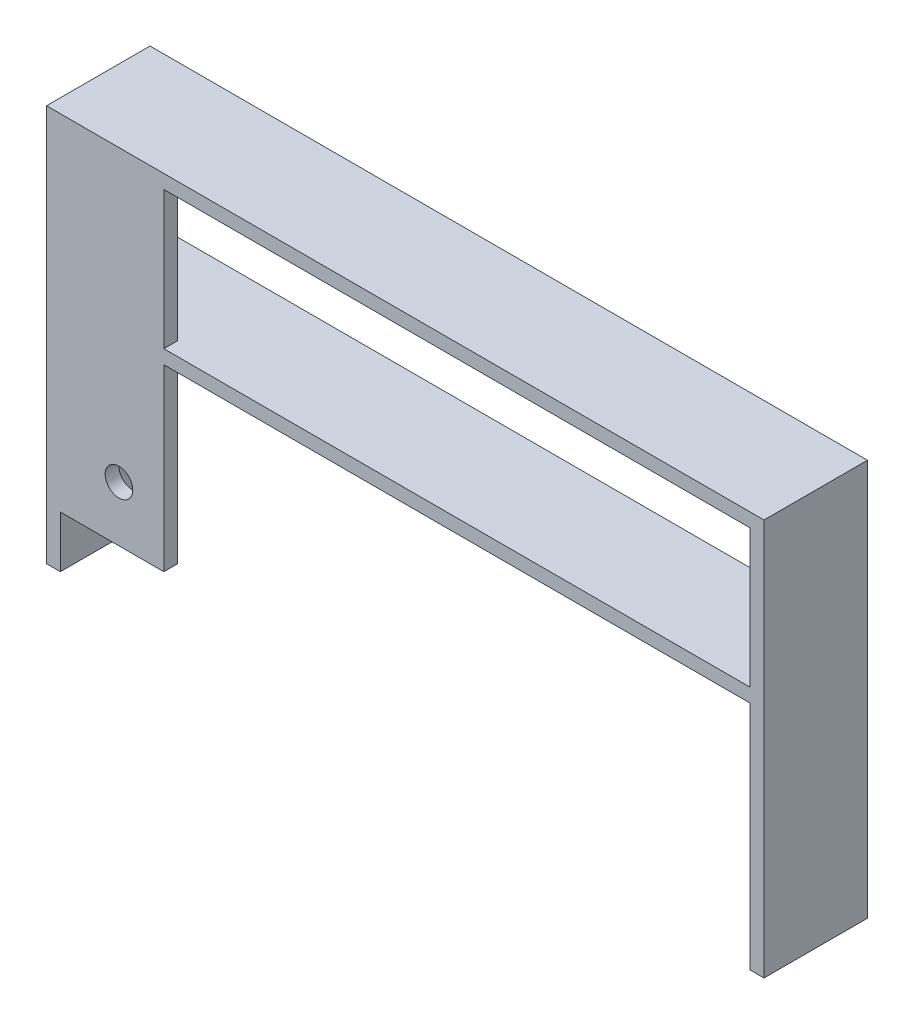
from build123d import *

# Parameters (mm, degrees)
SKETCH1_W           = 100
SKETCH1_H           = 20
BOSS_EXTRUDE1_DEPTH = 15
SKETCH2_W           = 15
SKETCH2_H           = 20
BOSS_EXTRUDE2_DEPTH = 2
SKETCH3_W           = 15
SKETCH3_H           = 26
BOSS_EXTRUDE3_DEPTH = 2
CUT_EXTRUDE1_REACH  = 119.81
SKETCH4_R           = 2


with BuildPart() as part:
    # Sketch1 → Boss-Extrude1 (new body)
    with BuildSketch(Plane.XY):
        Polygon((0, 0), (0, 33.5), (100, 33.5), (100, 0), (102, 0), (102, 57.5), (-2, 57.5), (-2, 0), align=None)
        with Locations((50, 45.5)):
            Rectangle(SKETCH1_W, SKETCH1_H, mode=Mode.SUBTRACT)
    extrude(amount=BOSS_EXTRUDE1_DEPTH)

    # Sketch2 → Boss-Extrude2 (add)
    with BuildSketch(Plane(origin=(0, 0, 15), x_dir=(-1, 0, 0), z_dir=(0, 0, -1))):
        with Locations((-7.5, 45.5)):
            Rectangle(SKETCH2_W, SKETCH2_H)
    extrude(amount=BOSS_EXTRUDE2_DEPTH)

    # Sketch3 → Boss-Extrude3 (add)
    with BuildSketch(Plane.XY.offset(15)):
        with Locations((7.5, 20.5)):
            Rectangle(SKETCH3_W, SKETCH3_H)
    extrude(amount=-BOSS_EXTRUDE3_DEPTH)

    # Sketch4 → Cut-Extrude1 (cut, up to next)
    with BuildSketch(Plane(origin=(0, 0, 13), x_dir=(-1, 0, 0), z_dir=(0, 0, -1)), mode=Mode.PRIVATE) as cut_extrude1_sk1:
        with Locations((-8.5, 15.5)):
            Circle(SKETCH4_R)
    cut_extrude1_tool1 = extrude(cut_extrude1_sk1.sketch, amount=-CUT_EXTRUDE1_REACH, mode=Mode.PRIVATE) & part.part
    add(cut_extrude1_tool1.solids().sort_by_distance((8.5, 15.5, 13))[0], mode=Mode.SUBTRACT)


solid = part.part
